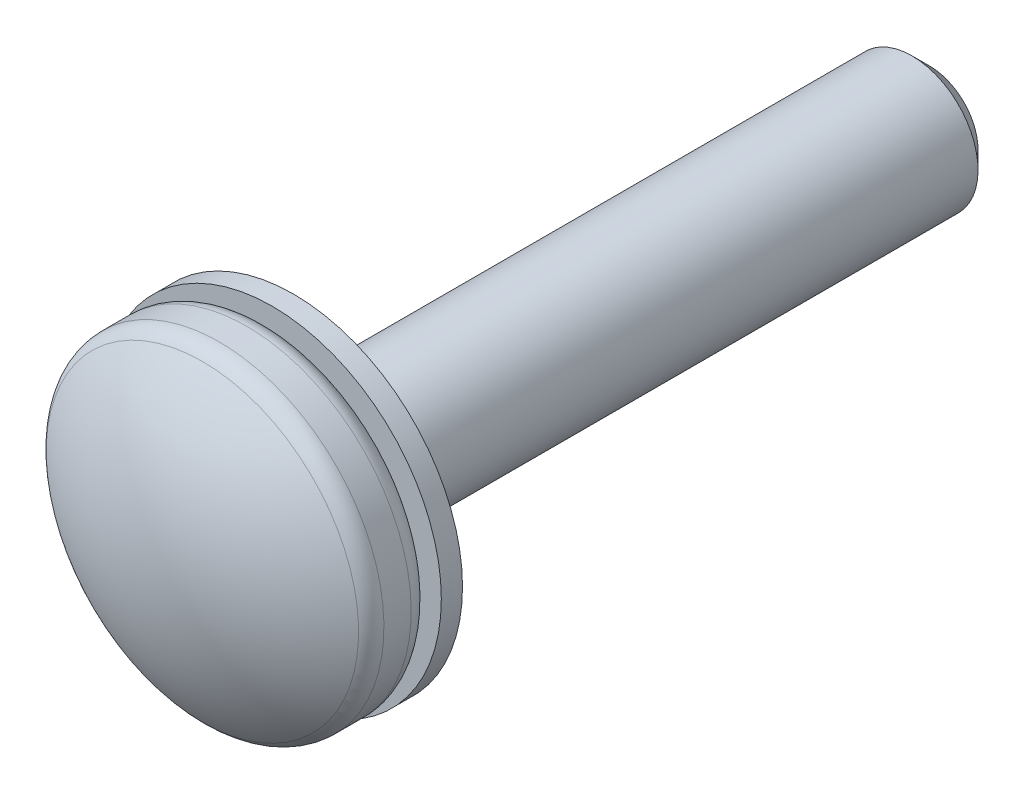
from build123d import *

# Parameters (mm, degrees)
SKETCH3_W      = 19.05
SKETCH3_H      = 1.897444252
SKETCH8_W      = 3.3782
SKETCH8_H      = 4.7371
SKETCH18_R     = 4.8641
SKETCH18_R_2   = 3.380772126
EXTRUDE1_DEPTH = 0.6096
CHAMFER1_SIZE  = 0.508


with BuildPart() as part:
    # Sketch3 → Revolve1 (revolve)
    with BuildSketch(Plane(origin=(0, 0, 0), x_dir=(0, 0, -1), z_dir=(1, 0, 0))):
        with Locations((-9.525, 0.948722126)):
            Rectangle(SKETCH3_W, SKETCH3_H)
    revolve(axis=Axis((0, 0, 0), (0, 0, 1)))

    # Sketch8 → Revolve2 (revolve)
    with BuildSketch(Plane(origin=(0, 0, 0), x_dir=(0, 0, -1), z_dir=(1, 0, 0))):
        with Locations((-20.7391, 2.36855)):
            Rectangle(SKETCH8_W, SKETCH8_H)
    revolve(axis=Axis((0, 0, 0), (0, 0, 1)))

    # Sketch11 → Cut-Revolve3 (revolve, cut)
    with BuildSketch(Plane(origin=(0, 0, 0), x_dir=(0, 0, -1), z_dir=(1, 0, 0))):
        with BuildLine():
            Line((-20.443130449, 4.7371), (-19.658076, 4.7371))
            ThreePointArc((-19.658076, 4.7371), (-19.228101337, 4.558998663), (-19.05, 4.129024))
            Line((-19.05, 4.129024), (-18.415, 4.129024))
            Line((-18.415, 4.129024), (-18.415, 5.3721))
            Line((-18.415, 5.3721), (-23.0632, 5.3721))
            Line((-23.0632, 5.3721), (-23.0632, 0))
            Line((-23.0632, 0), (-22.4282, 0))
            ThreePointArc((-22.4282, 0), (-22.043646213, 2.368662391), (-20.929487499, 4.494007892))
            ThreePointArc((-20.929487499, 4.494007892), (-20.714992985, 4.672942361), (-20.443130449, 4.7371))
        make_face()
    revolve(axis=Axis((0, 0, 22.4282), (0, 0, -1)), mode=Mode.SUBTRACT)

    # Chamfer1
    chamfer1_edges = [part.edges().sort_by_distance(p)[0] for p in [
        (0, -1.897444252, 0),
    ]]
    chamfer(chamfer1_edges, length=CHAMFER1_SIZE)


with BuildPart() as body_2:
    # Sketch18 → Extrude1 (new body)
    with BuildSketch(Plane.XY.offset(18.918698413)):
        Circle(SKETCH18_R)
        Circle(SKETCH18_R_2, mode=Mode.SUBTRACT)
    extrude(amount=-EXTRUDE1_DEPTH)


solid = Compound([part.part, body_2.part])
